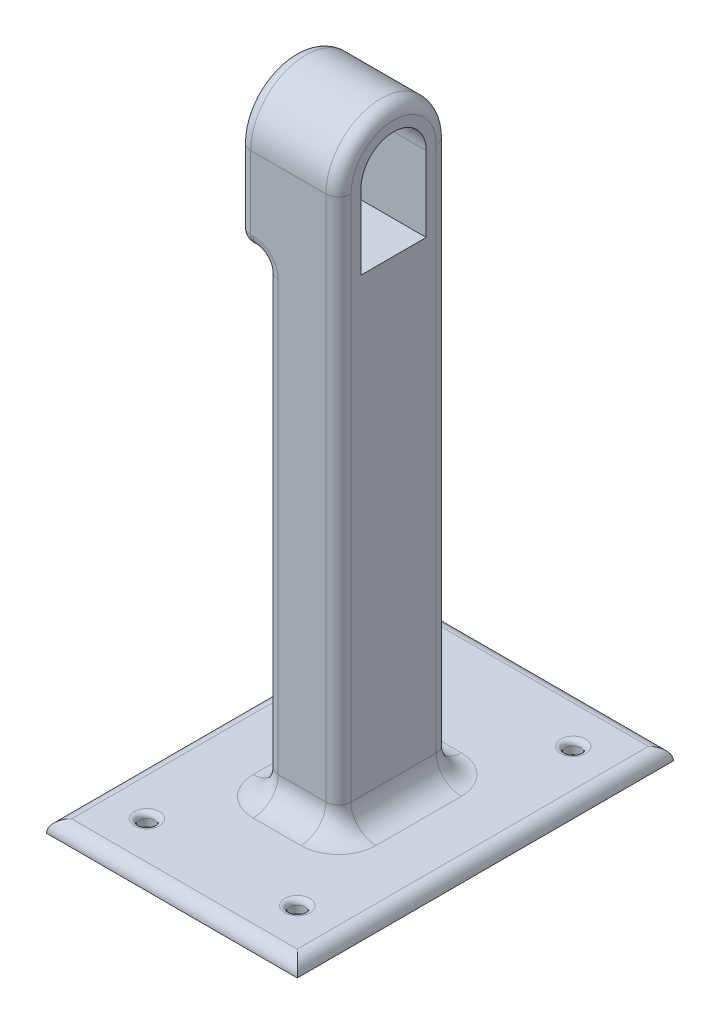
from build123d import *

# Parameters (mm, degrees)
SKETCH1_W           = 100
SKETCH1_H           = 150
SKETCH1_R           = 3
BOTTOM_DEPTH        = 5
SKETCH2_W           = 29
SKETCH2_H           = 44
SKETCH2_W_2         = 21
SKETCH2_H_2         = 36
BOSS_EXTRUDE2_DEPTH = 190
BOSS_EXTRUDE3_DEPTH = 40
CUT_EXTRUDE1_DEPTH  = 35
SKETCH5_W           = 40
SKETCH5_H           = 44
BOSS_EXTRUDE4_DEPTH = 4
FILLET1_R           = 5
FILLET3_R           = 5
FILLET4_R           = 5
FILLET5_R           = 10
FILLET6_R           = 5
FILLET7_R           = 2


# Some blends are built 0.0001 mm under size
with BuildPart() as part:
    # Sketch1 → bottom (new body)
    with BuildSketch(Plane(origin=(0, 0, 0), x_dir=(1, 0, 0), z_dir=(0, 1, 0))):
        with Locations((50, -75)):
            Rectangle(SKETCH1_W, SKETCH1_H)
        with Locations(Location((20, -20, 0), (0, 0, 270))):
            Circle(SKETCH1_R, mode=Mode.SUBTRACT)
        with Locations(Location((80, -20, 0), (0, 0, 90))):
            Circle(SKETCH1_R, mode=Mode.SUBTRACT)
        with Locations(Location((80, -130, 0), (0, 0, 270))):
            Circle(SKETCH1_R, mode=Mode.SUBTRACT)
        with Locations(Location((20, -130, 0), (0, 0, 90))):
            Circle(SKETCH1_R, mode=Mode.SUBTRACT)
    extrude(amount=BOTTOM_DEPTH)

    # Sketch2 → Boss-Extrude2 (add)
    with BuildSketch(Plane(origin=(0, 5, 0), x_dir=(1, 0, 0), z_dir=(0, 1, 0))):
        with Locations((50.459110832, -76.558815358)):
            Rectangle(SKETCH2_W, SKETCH2_H)
        with Locations((50.459110832, -76.558815358)):
            Rectangle(SKETCH2_W_2, SKETCH2_H_2, mode=Mode.SUBTRACT)
    extrude(amount=BOSS_EXTRUDE2_DEPTH)

    # Sketch3 → Boss-Extrude3 (add)
    with BuildSketch(Plane(origin=(64.959110832, 0, 0), x_dir=(0, 0, -1), z_dir=(1, 0, 0))):
        with BuildLine():
            Line((-98.558815358, 195), (-98.558815358, 225))
            ThreePointArc((-98.558815358, 225), (-76.558815358, 247), (-54.558815358, 225))
            Line((-54.558815358, 225), (-54.558815358, 195))
            Line((-54.558815358, 195), (-98.558815358, 195))
        make_face()
    extrude(amount=-BOSS_EXTRUDE3_DEPTH)

    # Sketch4 → Cut-Extrude1 (cut)
    with BuildSketch(Plane(origin=(64.959110832, 0, 0), x_dir=(0, 0, -1), z_dir=(1, 0, 0))):
        with BuildLine():
            Line((-89.558815358, 195), (-89.558815358, 225))
            ThreePointArc((-89.558815358, 225), (-76.558815358, 238), (-63.558815358, 225))
            Line((-63.558815358, 225), (-63.558815358, 195))
            Line((-63.558815358, 195), (-89.558815358, 195))
        make_face()
    extrude(amount=-CUT_EXTRUDE1_DEPTH, mode=Mode.SUBTRACT)

    # Sketch5 → Boss-Extrude4 (add)
    with BuildSketch(Plane.XZ.offset(-195)):
        with Locations((44.959110832, 76.558815358)):
            Rectangle(SKETCH5_W, SKETCH5_H)
    extrude(amount=BOSS_EXTRUDE4_DEPTH)

    # Fillet1
    fillet1_edges = [part.edges().sort_by_distance(p)[0] for p in [
        (24.959110832, 191, 76.558815358),
        (24.959110832, 208, 98.558815358),
        (24.959110832, 247, 76.558815358),
        (24.959110832, 208, 54.558815358),
    ]]
    fillet(fillet1_edges, radius=FILLET1_R)

    # Fillet3
    # the kernel refuses this fillet: 5 mm, written as the material it adds along each edge
    with BuildSketch(Plane(origin=(35.959110832, 191, 54.558815358), x_dir=(-1, 0, 0), z_dir=(0, 0, 1))) as fillet3_piece_1:
        with BuildLine():
            CenterArc((FILLET3_R, FILLET3_R), FILLET3_R, 180, 90)
            Line((0, FILLET3_R), (0, 0))
            Line((0, 0), (FILLET3_R, 0))
        make_face()
    extrude(amount=44)
    # the kernel refuses this fillet: 5 mm, written as the material it takes off along each edge
    with BuildSketch(Plane(origin=(29.959110832, 196, 59.558815358), x_dir=(0, 0, -1), z_dir=(0, -1, 0))) as fillet3_2_piece_1_section:
        Polygon((0, 0), (FILLET3_R * 1.02, 0), (FILLET3_R * 1.02, -FILLET3_R * 1.02), (0, -FILLET3_R * 1.02), align=None)
    fillet3_2_piece_1 = extrude(amount=FILLET3_R * 1.02, mode=Mode.PRIVATE)
    fillet3_2_piece_1 = fillet3_2_piece_1 - Plane(origin=(29.959110832, 196, 59.558815358), x_dir=(0.7071067811865475, 0, 0.7071067811865475), z_dir=(0, -1, 0)) * Sphere(FILLET3_R, mode=Mode.PRIVATE)
    add(fillet3_2_piece_1, mode=Mode.SUBTRACT)
    with BuildSketch(Plane(origin=(29.959110832, 196, 93.558815358), x_dir=(0, 0, 1), z_dir=(0, -1, 0))) as fillet3_2_piece_2_section:
        Polygon((0, 0), (FILLET3_R * 1.02, 0), (FILLET3_R * 1.02, FILLET3_R * 1.02), (0, FILLET3_R * 1.02), align=None)
    fillet3_2_piece_2 = extrude(amount=FILLET3_R * 1.02, mode=Mode.PRIVATE)
    fillet3_2_piece_2 = fillet3_2_piece_2 - Plane(origin=(29.959110832, 196, 93.558815358), x_dir=(0.7071067811865475, 0, -0.7071067811865475), z_dir=(0, -1, 0)) * Sphere(FILLET3_R, mode=Mode.PRIVATE)
    add(fillet3_2_piece_2, mode=Mode.SUBTRACT)
    with BuildSketch(Plane(origin=(35.959110832, 5, 98.558815358), x_dir=(1, 0, 0), z_dir=(0, 1, 0))) as fillet3_2_piece_3:
        with BuildLine():
            CenterArc((FILLET3_R, FILLET3_R), FILLET3_R, 180, 90)
            Line((0, FILLET3_R), (0, 0))
            Line((0, 0), (FILLET3_R, 0))
        make_face()
    extrude(amount=181, mode=Mode.SUBTRACT)
    with BuildSketch(Plane(origin=(35.959110832, 5, 54.558815358), x_dir=(1, 0, 0), z_dir=(0, 1, 0))) as fillet3_2_piece_4:
        with BuildLine():
            CenterArc((FILLET3_R, -FILLET3_R), FILLET3_R, 90, 90)
            Line((0, -FILLET3_R), (0, 0))
            Line((0, 0), (FILLET3_R, 0))
        make_face()
    extrude(amount=181, mode=Mode.SUBTRACT)
    with BuildSketch(Plane(origin=(29.959110832, 191, 98.558815358), x_dir=(0, 0, -1), z_dir=(1, 0, 0)), Plane(origin=(30.959110832, 191, 54.558815358), x_dir=(0, 0, 1), z_dir=(-1, 0, 0))) as fillet3_2_piece_5:
        with BuildLine():
            CenterArc((FILLET3_R, FILLET3_R), FILLET3_R, 180, 90)
            Line((0, FILLET3_R), (0, 0))
            Line((0, 0), (FILLET3_R, 0))
        make_face()
    extrude(amount=1, mode=Mode.SUBTRACT)
    with BuildSketch(Plane(origin=(30.959110832, 186, 54.558815358), x_dir=(0, 1, 0), z_dir=(-1, 0, 0))) as fillet3_2_piece_6:
        with BuildLine():
            CenterArc((5 + FILLET3_R, -FILLET3_R), FILLET3_R, 90, 90)
            Line((5 + FILLET3_R, 0), (5, 0))
            Line((5, 0), (5, -FILLET3_R))
        make_face()
    revolve(axis=Axis((30.959110832, 186, 54.558815358), (0, 0, -1)), revolution_arc=90, mode=Mode.SUBTRACT)
    with BuildSketch(Plane(origin=(30.959110832, 186, 98.558815358), x_dir=(0, 1, 0), z_dir=(-1, 0, 0))) as fillet3_2_piece_7:
        with BuildLine():
            CenterArc((5 + FILLET3_R, FILLET3_R), FILLET3_R, 180, 90)
            Line((5 + FILLET3_R, 0), (5, 0))
            Line((5, 0), (5, FILLET3_R))
        make_face()
    revolve(axis=Axis((30.959110832, 186, 98.558815358), (0, 0, -1)), revolution_arc=90, mode=Mode.SUBTRACT)

    # Fillet4
    fillet4_edges = [part.edges().sort_by_distance(p)[0] for p in [
        (64.959110832, 115, 54.558815358),
        (64.959110832, 115, 98.558815358),
        (64.959110832, 247, 76.558815358),
    ]]
    fillet(fillet4_edges, radius=FILLET4_R)

    # Fillet5
    fillet5_edges = [part.edges().sort_by_distance(p)[0] for p in [
        (50.459110832, 5, 98.558815358),
        (50.459110832, 5, 54.558815358),
        (35.959110832, 5, 76.558815358),
        (37.423576926, 5, 56.023281452),
        (37.423576926, 5, 97.094349264),
        (64.959110832, 5, 76.558815358),
        (63.494644738, 5, 97.094349264),
        (63.494644738, 5, 56.023281452),
    ]]
    fillet(fillet5_edges, radius=FILLET5_R)

    # Fillet6
    fillet6_edges = [part.edges().sort_by_distance(p)[0] for p in [
        (100, 5, 75),
        (50, 5, 0),
        (0, 5, 75),
        (50, 5, 150),
    ]]
    fillet(fillet6_edges, radius=FILLET6_R - 0.0001)  # a hair under: the kernel refuses the full size

    # Fillet7
    fillet7_edges = [part.edges().sort_by_distance(p)[0] for p in [
        (20, 5, 17),
        (80, 5, 23),
        (80, 5, 127),
        (20, 5, 133),
    ]]
    fillet(fillet7_edges, radius=FILLET7_R)


solid = part.part
